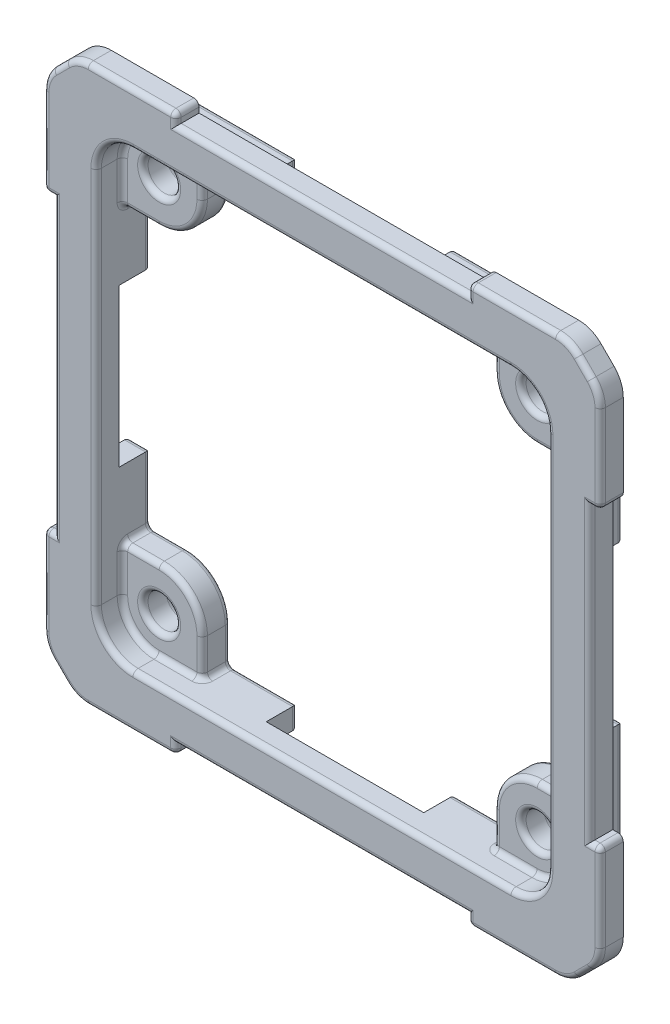
from build123d import *

# Parameters (mm, degrees)
SKETCH3_R               = 1.55
BOSS_EXTRUDE1_DEPTH     = 5.2
CUT_EXTRUDE1_START      = -2.5
CUT_EXTRUDE1_DEPTH      = 2.5
FILLET1_R               = 0.5
CUT_EXTRUDE2_DEPTH      = 3
CUT_EXTRUDE3_DEPTH      = 3
CUT_EXTRUDE3_DEPTH_BACK = 3
FILLET2_R               = 0.5
FILLET3_R               = 0.5


# Read off the part's stored shape, not the designer's step: Cut-Extrude2
with BuildPart() as part:
    # Sketch3 → Boss-Extrude1 (new body)
    with BuildSketch(Plane.XY):
        with BuildLine():
            Line((4.242640687, 0), (12.6, 0))
            Line((12.6, 0), (12.6, 1))
            Line((12.6, 1), (40.4, 1))
            Line((40.4, 1), (40.4, 0))
            Line((40.4, 0), (48.757359313, 0))
            ThreePointArc((48.757359313, 0), (49.90540961, 0.228361402), (50.878679656, 0.878679656))
            Line((50.878679656, 0.878679656), (52.121320344, 2.121320344))
            ThreePointArc((52.121320344, 2.121320344), (52.771638598, 3.09459039), (53, 4.242640687))
            Line((53, 4.242640687), (53, 12.6))
            Line((53, 12.6), (52, 12.6))
            Line((52, 12.6), (52, 40.4))
            Line((52, 40.4), (53, 40.4))
            Line((53, 40.4), (53, 48.757359313))
            ThreePointArc((53, 48.757359313), (52.771638598, 49.90540961), (52.121320344, 50.878679656))
            Line((52.121320344, 50.878679656), (50.878679656, 52.121320344))
            ThreePointArc((50.878679656, 52.121320344), (49.90540961, 52.771638598), (48.757359313, 53))
            Line((48.757359313, 53), (40.4, 53))
            Line((40.4, 53), (40.4, 52))
            Line((40.4, 52), (12.6, 52))
            Line((12.6, 52), (12.6, 53))
            Line((12.6, 53), (4.242640687, 53))
            ThreePointArc((4.242640687, 53), (3.09459039, 52.771638598), (2.121320344, 52.121320344))
            Line((2.121320344, 52.121320344), (0.878679656, 50.878679656))
            ThreePointArc((0.878679656, 50.878679656), (0.228361402, 49.90540961), (0, 48.757359313))
            Line((0, 48.757359313), (0, 40.4))
            Line((0, 40.4), (1, 40.4))
            Line((1, 40.4), (1, 12.6))
            Line((1, 12.6), (0, 12.6))
            Line((0, 12.6), (0, 4.242640687))
            ThreePointArc((0, 4.242640687), (0.228361402, 3.09459039), (0.878679656, 2.121320344))
            Line((0.878679656, 2.121320344), (2.121320344, 0.878679656))
            ThreePointArc((2.121320344, 0.878679656), (3.09459039, 0.228361402), (4.242640687, 0))
        make_face()
        with Locations((8.5, 8.5)):
            Circle(SKETCH3_R, mode=Mode.SUBTRACT)
        with Locations(Location((44.5, 8.5, 0), (0, 0, 180))):
            Circle(SKETCH3_R, mode=Mode.SUBTRACT)
        with Locations((44.5, 44.5)):
            Circle(SKETCH3_R, mode=Mode.SUBTRACT)
        with Locations(Location((8.5, 44.5, 0), (0, 0, 180))):
            Circle(SKETCH3_R, mode=Mode.SUBTRACT)
        with BuildLine():
            Line((12.6, 8.5), (12.6, 5))
            Line((12.6, 5), (40.4, 5))
            Line((40.4, 5), (40.4, 8.5))
            ThreePointArc((40.4, 8.5), (41.600862197, 11.399137803), (44.5, 12.6))
            Line((44.5, 12.6), (48, 12.6))
            Line((48, 12.6), (48, 40.4))
            Line((48, 40.4), (44.5, 40.4))
            ThreePointArc((44.5, 40.4), (41.600862197, 41.600862197), (40.4, 44.5))
            Line((40.4, 44.5), (40.4, 48))
            Line((40.4, 48), (12.6, 48))
            Line((12.6, 48), (12.6, 44.5))
            ThreePointArc((12.6, 44.5), (11.399137803, 41.600862197), (8.5, 40.4))
            Line((8.5, 40.4), (5, 40.4))
            Line((5, 40.4), (5, 12.6))
            Line((5, 12.6), (8.5, 12.6))
            ThreePointArc((8.5, 12.6), (11.399137803, 11.399137803), (12.6, 8.5))
        make_face(mode=Mode.SUBTRACT)
    extrude(amount=BOSS_EXTRUDE1_DEPTH)

    # Sketch4 → Cut-Extrude1 (cut)
    with BuildSketch(Plane.XY.offset(5.2).offset(CUT_EXTRUDE1_START)):
        with BuildLine():
            Line((8.5, 5), (12.6, 5))
            Line((12.6, 5), (12.6, 8.5))
            ThreePointArc((12.6, 8.5), (11.399137803, 11.399137803), (8.5, 12.6))
            Line((8.5, 12.6), (5, 12.6))
            Line((5, 12.6), (5, 8.5))
            ThreePointArc((5, 8.5), (6.025126266, 6.025126266), (8.5, 5))
        make_face()
        with BuildLine():
            Line((48, 12.6), (44.5, 12.6))
            ThreePointArc((44.5, 12.6), (41.600862197, 11.399137803), (40.4, 8.5))
            Line((40.4, 8.5), (40.4, 5))
            Line((40.4, 5), (44.5, 5))
            ThreePointArc((44.5, 5), (46.974873734, 6.025126266), (48, 8.5))
            Line((48, 8.5), (48, 12.6))
        make_face()
        with BuildLine():
            Line((5, 40.4), (8.5, 40.4))
            ThreePointArc((8.5, 40.4), (11.399137803, 41.600862197), (12.6, 44.5))
            Line((12.6, 44.5), (12.6, 48))
            Line((12.6, 48), (8.5, 48))
            ThreePointArc((8.5, 48), (6.025126266, 46.974873734), (5, 44.5))
            Line((5, 44.5), (5, 40.4))
        make_face()
        with BuildLine():
            Line((44.5, 48), (40.4, 48))
            Line((40.4, 48), (40.4, 44.5))
            ThreePointArc((40.4, 44.5), (41.600862197, 41.600862197), (44.5, 40.4))
            Line((44.5, 40.4), (48, 40.4))
            Line((48, 40.4), (48, 44.5))
            ThreePointArc((48, 44.5), (46.974873734, 46.974873734), (44.5, 48))
        make_face()
    extrude(amount=CUT_EXTRUDE1_DEPTH, mode=Mode.SUBTRACT)

    # Fillet1
    fillet1_edges = [part.edges().sort_by_distance(p)[0] for p in [
        (40.4, 0.5, 5.2),
        (44.578679656, 0, 5.2),
        (6.025126266, 6.025126266, 5.2),
        (49.90540961, 0.228361402, 5.2),
        (46.974873734, 6.025126266, 5.2),
        (51.5, 1.5, 5.2),
        (46.974873734, 46.974873734, 5.2),
        (6.025126266, 46.974873734, 5.2),
        (52.771638598, 3.09459039, 5.2),
        (53, 8.421320344, 5.2),
        (52.5, 12.6, 5.2),
        (52, 26.5, 5.2),
        (52.5, 40.4, 5.2),
        (53, 44.578679656, 5.2),
        (12.6, 0.5, 5.2),
        (52.771638598, 49.90540961, 5.2),
        (51.5, 51.5, 5.2),
        (49.90540961, 52.771638598, 5.2),
        (44.578679656, 53, 5.2),
        (40.4, 52.5, 5.2),
        (26.5, 52, 5.2),
        (12.6, 52.5, 5.2),
        (8.421320344, 53, 5.2),
        (3.09459039, 52.771638598, 5.2),
        (1.5, 51.5, 5.2),
        (26.5, 1, 5.2),
        (0.228361402, 49.90540961, 5.2),
        (0, 44.578679656, 5.2),
        (0.5, 40.4, 5.2),
        (1, 26.5, 5.2),
        (0.5, 12.6, 5.2),
        (0, 8.421320344, 5.2),
        (0.228361402, 3.09459039, 5.2),
        (1.5, 1.5, 5.2),
        (26.5, 5, 5.2),
        (3.09459039, 0.228361402, 5.2),
        (48, 26.5, 5.2),
        (26.5, 48, 5.2),
        (5, 26.5, 5.2),
        (8.421320344, 0, 5.2),
    ]]
    fillet(fillet1_edges, radius=FILLET1_R)

    # Cut-Extrude2 outline → Cut-Extrude2 (cut)
    with BuildSketch(Plane.XY):
        with BuildLine():
            Line((40.4, 1), (40.4, 0))
            Line((40.4, 0), (48.757359313, 0))
            ThreePointArc((48.757359313, 0), (49.90540961, 0.228361402), (50.878679656, 0.878679656))
            Line((50.878679656, 0.878679656), (52.121320344, 2.121320344))
            ThreePointArc((52.121320344, 2.121320344), (52.771638598, 3.09459039), (53, 4.242640687))
            Line((53, 4.242640687), (53, 12.6))
            Line((53, 12.6), (52, 12.6))
            Line((52, 12.6), (52, 40.4))
            Line((52, 40.4), (53, 40.4))
            Line((53, 40.4), (53, 48.757359313))
            ThreePointArc((53, 48.757359313), (52.771638598, 49.90540961), (52.121320344, 50.878679656))
            Line((52.121320344, 50.878679656), (50.878679656, 52.121320344))
            ThreePointArc((50.878679656, 52.121320344), (49.90540961, 52.771638598), (48.757359313, 53))
            Line((48.757359313, 53), (40.4, 53))
            Line((40.4, 53), (40.4, 52))
            Line((40.4, 52), (12.6, 52))
            Line((12.6, 52), (12.6, 53))
            Line((12.6, 53), (4.242640687, 53))
            ThreePointArc((4.242640687, 53), (3.09459039, 52.771638598), (2.121320344, 52.121320344))
            Line((2.121320344, 52.121320344), (0.878679656, 50.878679656))
            ThreePointArc((0.878679656, 50.878679656), (0.228361402, 49.90540961), (0, 48.757359313))
            Line((0, 48.757359313), (0, 40.4))
            Line((0, 40.4), (1, 40.4))
            Line((1, 40.4), (1, 12.6))
            Line((1, 12.6), (0, 12.6))
            Line((0, 12.6), (0, 4.242640687))
            ThreePointArc((0, 4.242640687), (0.228361402, 3.09459039), (0.878679656, 2.121320344))
            Line((0.878679656, 2.121320344), (2.121320344, 0.878679656))
            ThreePointArc((2.121320344, 0.878679656), (3.09459039, 0.228361402), (4.242640687, 0))
            Line((4.242640687, 0), (12.6, 0))
            Line((12.6, 0), (12.6, 1))
            Line((12.6, 1), (40.4, 1))
        make_face()
        with BuildLine():
            Line((3, 44.5), (4, 44.5))
            ThreePointArc((4, 44.5), (5.318019272, 47.681980303), (8.4999994, 49))
            Line((8.4999994, 49), (8.4999994, 50))
            Line((8.4999994, 50), (18.9999994, 50))
            Line((18.9999994, 50), (18.9999994, 48))
            Line((18.9999994, 48), (34.0000006, 48))
            Line((34.0000006, 48), (34.0000006, 50))
            Line((34.0000006, 50), (44.5000006, 50))
            Line((44.5000006, 50), (44.5000006, 49))
            ThreePointArc((44.5000006, 49), (47.681980728, 47.681980303), (49, 44.5))
            Line((49, 44.5), (50, 44.5))
            Line((50, 44.5), (50, 34.0000006))
            Line((50, 34.0000006), (48, 34.0000006))
            Line((48, 34.0000006), (48, 18.9999994))
            Line((48, 18.9999994), (50, 18.9999994))
            Line((50, 18.9999994), (50, 8.5))
            Line((50, 8.5), (49, 8.5))
            ThreePointArc((49, 8.5), (47.681980728, 5.318019697), (44.5000006, 4))
            Line((44.5000006, 4), (44.5000006, 3))
            Line((44.5000006, 3), (34.0000006, 3))
            Line((34.0000006, 3), (34.0000006, 5))
            Line((34.0000006, 5), (18.9999994, 5))
            Line((18.9999994, 5), (18.9999994, 3))
            Line((18.9999994, 3), (8.4999994, 3))
            Line((8.4999994, 3), (8.4999994, 4))
            ThreePointArc((8.4999994, 4), (5.318019272, 5.318019697), (4, 8.5))
            Line((4, 8.5), (3, 8.5))
            Line((3, 8.5), (3, 18.9999994))
            Line((3, 18.9999994), (5, 18.9999994))
            Line((5, 18.9999994), (5, 34.0000006))
            Line((5, 34.0000006), (3, 34.0000006))
            Line((3, 34.0000006), (3, 44.5))
        make_face(mode=Mode.SUBTRACT)
    extrude(amount=CUT_EXTRUDE2_DEPTH, mode=Mode.SUBTRACT)

    # Sketch8 → Cut-Extrude3 (cut, two sides: drawn at the far end of the back side and taken through both)
    with BuildSketch(Plane(origin=(26.5, 0, 0), x_dir=(0, 0, -1), z_dir=(1, 0, 0)).offset(-CUT_EXTRUDE3_DEPTH_BACK)):
        Polygon((-3, 1), (-4.2, 1), (-3, 2), align=None)
    extrude(amount=CUT_EXTRUDE3_DEPTH + CUT_EXTRUDE3_DEPTH_BACK, mode=Mode.SUBTRACT)

    # Fillet2
    fillet2_edges = [part.edges().sort_by_distance(p)[0] for p in [
        (6.95, 8.5, 0),
        (46.05, 8.5, 0),
        (42.95, 44.5, 0),
        (10.05, 44.5, 0),
        (5, 12.6, 1.35),
        (12.6, 5, 1.35),
        (6.95, 8.5, 2.7),
        (6.025126266, 6.025126266, 2.7),
        (5, 10.55, 2.7),
        (6.75, 12.6, 2.7),
        (11.399137803, 11.399137803, 2.7),
        (12.6, 6.75, 2.7),
        (10.55, 5, 2.7),
        (5, 40.4, 1.35),
        (12.6, 48, 1.35),
        (40.4, 48, 1.35),
        (48, 40.4, 1.35),
        (48, 12.6, 1.35),
        (40.4, 5, 1.35),
        (41.600862197, 11.399137803, 2.7),
        (46.25, 12.6, 2.7),
        (48, 10.55, 2.7),
        (46.974873734, 6.025126266, 2.7),
        (42.45, 5, 2.7),
        (40.4, 6.75, 2.7),
        (46.05, 8.5, 2.7),
        (42.95, 44.5, 2.7),
        (46.974873734, 46.974873734, 2.7),
        (48, 42.45, 2.7),
        (46.25, 40.4, 2.7),
        (41.600862197, 41.600862197, 2.7),
        (40.4, 46.25, 2.7),
        (42.45, 48, 2.7),
        (11.399137803, 41.600862197, 2.7),
        (6.75, 40.4, 2.7),
        (5, 42.45, 2.7),
        (6.025126266, 46.974873734, 2.7),
        (10.55, 48, 2.7),
        (12.6, 46.25, 2.7),
        (10.05, 44.5, 2.7),
        (5, 15.7999997, 0),
        (15.7999997, 48, 0),
        (48, 37.2000003, 0),
        (37.2000003, 5, 0),
        (5.318019272, 47.681980303, 0),
        (3.5, 44.5, 0),
        (3, 39.2500003, 0),
        (4, 34.0000006, 0),
        (4, 18.9999994, 0),
        (3, 13.7499997, 0),
        (3.5, 8.5, 0),
        (5.318019272, 5.318019697, 0),
        (8.4999994, 3.5, 0),
        (13.7499994, 3, 0),
        (18.9999994, 4, 0),
        (34.0000006, 4, 0),
        (39.2500006, 3, 0),
        (44.5000006, 3.5, 0),
        (47.681980728, 5.318019697, 0),
        (49.5, 8.5, 0),
        (50, 13.7499997, 0),
        (49, 18.9999994, 0),
        (49, 34.0000006, 0),
        (50, 39.2500003, 0),
        (49.5, 44.5, 0),
        (47.681980728, 47.681980303, 0),
        (44.5000006, 49.5, 0),
        (39.2500006, 50, 0),
        (34.0000006, 49, 0),
        (18.9999994, 49, 0),
        (13.7499994, 50, 0),
        (8.4999994, 49.5, 0),
        (11.399137803, 11.399137803, 0),
        (12.6, 6.75, 0),
        (15.7999997, 5, 0),
        (40.4, 6.75, 0),
        (41.600862197, 11.399137803, 0),
        (46.25, 12.6, 0),
        (48, 15.7999997, 0),
        (46.25, 40.4, 0),
        (41.600862197, 41.600862197, 0),
        (40.4, 46.25, 0),
        (37.2000003, 48, 0),
        (12.6, 46.25, 0),
        (11.399137803, 41.600862197, 0),
        (6.75, 40.4, 0),
        (5, 37.2000003, 0),
        (6.75, 12.6, 0),
    ]]
    fillet(fillet2_edges, radius=FILLET2_R)

    # Fillet3
    # the kernel refuses this fillet: 0.5 mm, written as the material it takes off along each edge
    with BuildSketch(Plane(origin=(40.9, 52.5, 4.7), x_dir=(0, 1, 0), z_dir=(-1, 0, 0))) as fillet3_piece_1_section:
        Polygon((0, 0), (FILLET3_R, 0), (FILLET3_R, -FILLET3_R), (0, -FILLET3_R), align=None)
    fillet3_piece_1 = extrude(amount=FILLET3_R, mode=Mode.PRIVATE)
    fillet3_piece_1 = fillet3_piece_1 - Plane(origin=(40.9, 52.5, 4.7), x_dir=(0, -0.7071067811865475, -0.7071067811865475), z_dir=(-1, 0, 0)) * Sphere(FILLET3_R, mode=Mode.PRIVATE)
    add(fillet3_piece_1, mode=Mode.SUBTRACT)
    with BuildSketch(Plane(origin=(12.1, 52.5, 4.7), x_dir=(1, 0, 0), z_dir=(0, 1, 0))) as fillet3_piece_2_section:
        Polygon((0, 0), (FILLET3_R, 0), (FILLET3_R, -FILLET3_R), (0, -FILLET3_R), align=None)
    fillet3_piece_2 = extrude(amount=FILLET3_R, mode=Mode.PRIVATE)
    fillet3_piece_2 = fillet3_piece_2 - Plane(origin=(12.1, 52.5, 4.7), x_dir=(-0.7071067811865475, 0, -0.7071067811865475), z_dir=(0, 1, 0)) * Sphere(FILLET3_R, mode=Mode.PRIVATE)
    add(fillet3_piece_2, mode=Mode.SUBTRACT)
    with BuildSketch(Plane(origin=(52.5, 40.9, 4.7), x_dir=(0, -1, 0), z_dir=(1, 0, 0))) as fillet3_piece_3_section:
        Polygon((0, 0), (FILLET3_R, 0), (FILLET3_R, -FILLET3_R), (0, -FILLET3_R), align=None)
    fillet3_piece_3 = extrude(amount=FILLET3_R, mode=Mode.PRIVATE)
    fillet3_piece_3 = fillet3_piece_3 - Plane(origin=(52.5, 40.9, 4.7), x_dir=(-5.024295867788044e-15, 0.7071067811865475, -0.7071067811865475), z_dir=(1, 0, 0)) * Sphere(FILLET3_R, mode=Mode.PRIVATE)
    add(fillet3_piece_3, mode=Mode.SUBTRACT)
    with BuildSketch(Plane(origin=(52.5, 12.1, 4.7), x_dir=(1, 0, 0), z_dir=(0, 1, 0))) as fillet3_piece_4_section:
        Polygon((0, 0), (FILLET3_R, 0), (FILLET3_R, -FILLET3_R), (0, -FILLET3_R), align=None)
    fillet3_piece_4 = extrude(amount=FILLET3_R, mode=Mode.PRIVATE)
    fillet3_piece_4 = fillet3_piece_4 - Plane(origin=(52.5, 12.1, 4.7), x_dir=(-0.7071067811865475, 0, -0.7071067811865475), z_dir=(0, 1, 0)) * Sphere(FILLET3_R, mode=Mode.PRIVATE)
    add(fillet3_piece_4, mode=Mode.SUBTRACT)
    with BuildSketch(Plane(origin=(0.5, 40.9, 4.7), x_dir=(-1, 0, 0), z_dir=(0, -1, 0))) as fillet3_piece_5_section:
        Polygon((0, 0), (FILLET3_R, 0), (FILLET3_R, -FILLET3_R), (0, -FILLET3_R), align=None)
    fillet3_piece_5 = extrude(amount=FILLET3_R, mode=Mode.PRIVATE)
    fillet3_piece_5 = fillet3_piece_5 - Plane(origin=(0.5, 40.9, 4.7), x_dir=(0.7071067811865475, 0, -0.7071067811865475), z_dir=(0, -1, 0)) * Sphere(FILLET3_R, mode=Mode.PRIVATE)
    add(fillet3_piece_5, mode=Mode.SUBTRACT)
    with BuildSketch(Plane(origin=(0.5, 12.1, 4.7), x_dir=(0, 1, 0), z_dir=(-1, 0, 0))) as fillet3_piece_6_section:
        Polygon((0, 0), (FILLET3_R, 0), (FILLET3_R, -FILLET3_R), (0, -FILLET3_R), align=None)
    fillet3_piece_6 = extrude(amount=FILLET3_R, mode=Mode.PRIVATE)
    fillet3_piece_6 = fillet3_piece_6 - Plane(origin=(0.5, 12.1, 4.7), x_dir=(0, -0.7071067811865475, -0.7071067811865475), z_dir=(-1, 0, 0)) * Sphere(FILLET3_R, mode=Mode.PRIVATE)
    add(fillet3_piece_6, mode=Mode.SUBTRACT)
    with BuildSketch(Plane(origin=(40.9, 0.5, 4.7), x_dir=(-1, 0, 0), z_dir=(0, -1, 0))) as fillet3_piece_7_section:
        Polygon((0, 0), (FILLET3_R, 0), (FILLET3_R, -FILLET3_R), (0, -FILLET3_R), align=None)
    fillet3_piece_7 = extrude(amount=FILLET3_R, mode=Mode.PRIVATE)
    fillet3_piece_7 = fillet3_piece_7 - Plane(origin=(40.9, 0.5, 4.7), x_dir=(0.7071067811865475, 0, -0.7071067811865475), z_dir=(0, -1, 0)) * Sphere(FILLET3_R, mode=Mode.PRIVATE)
    add(fillet3_piece_7, mode=Mode.SUBTRACT)
    with BuildSketch(Plane(origin=(12.1, 0.5, 4.7), x_dir=(0, -1, 0), z_dir=(1, 0, 0))) as fillet3_piece_8_section:
        Polygon((0, 0), (FILLET3_R, 0), (FILLET3_R, -FILLET3_R), (0, -FILLET3_R), align=None)
    fillet3_piece_8 = extrude(amount=FILLET3_R, mode=Mode.PRIVATE)
    fillet3_piece_8 = fillet3_piece_8 - Plane(origin=(12.1, 0.5, 4.7), x_dir=(0, 0.7071067811865475, -0.7071067811865475), z_dir=(1, 0, 0)) * Sphere(FILLET3_R, mode=Mode.PRIVATE)
    add(fillet3_piece_8, mode=Mode.SUBTRACT)
    with BuildSketch(Plane(origin=(12.6, 0, 1.75), x_dir=(0, 1, 0), z_dir=(0, 0, 1)), Plane(origin=(0, 12.6, 1.75), x_dir=(0, -1, 0), z_dir=(0, 0, 1)), Plane(origin=(0, 40.4, 1.75), x_dir=(1, 0, 0), z_dir=(0, 0, 1)), Plane(origin=(12.6, 53, 1.75), x_dir=(-1, 0, 0), z_dir=(0, 0, 1)), Plane(origin=(40.4, 53, 1.75), x_dir=(0, -1, 0), z_dir=(0, 0, 1)), Plane(origin=(53, 40.4, 1.75), x_dir=(0, 1, 0), z_dir=(0, 0, 1)), Plane(origin=(53, 12.6, 1.75), x_dir=(-1, 0, 0), z_dir=(0, 0, 1)), Plane(origin=(40.4, 0, 1.75), x_dir=(1, 0, 0), z_dir=(0, 0, 1))) as fillet3_piece_9:
        with BuildLine():
            CenterArc((FILLET3_R, FILLET3_R), FILLET3_R, 180, 90)
            Line((0, FILLET3_R), (0, 0))
            Line((0, 0), (FILLET3_R, 0))
        make_face()
    extrude(amount=2.95, mode=Mode.SUBTRACT)


solid = part.part
